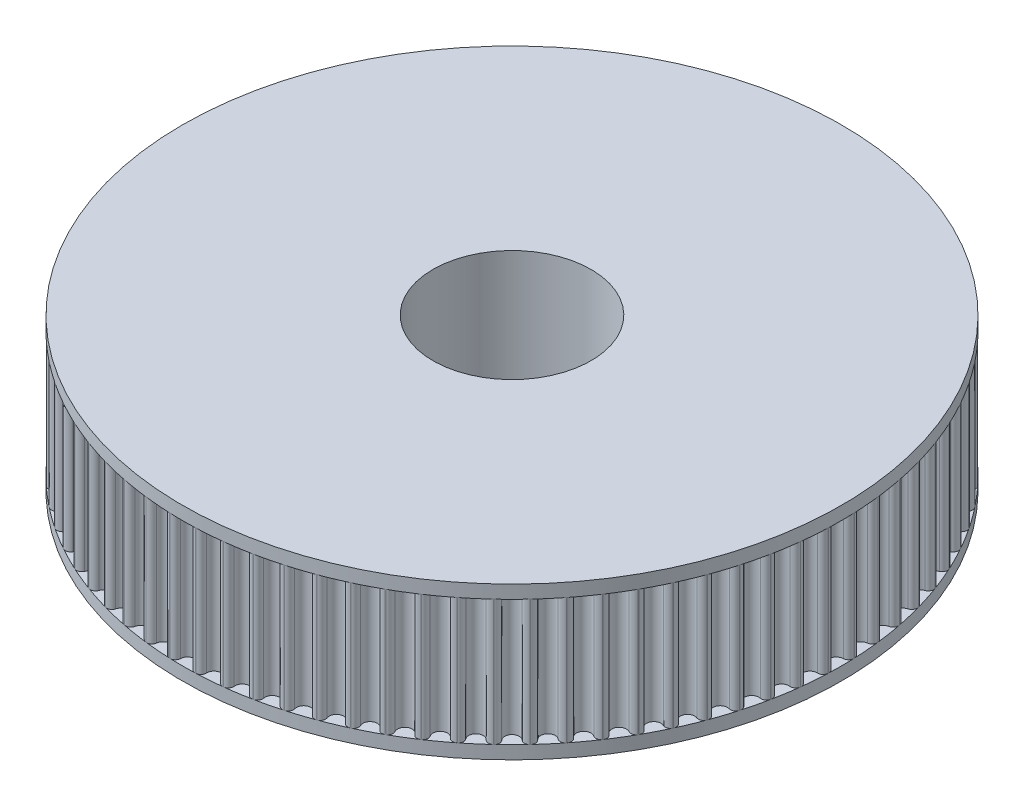
from build123d import *
from build123d.topology import SkipClean

# Parameters (mm, degrees)
CUT_EXTRUDE3_DEPTH  = 25
CIRPATTERN1_COUNT   = 80
SKETCH3_R           = 25
SKETCH3_R_2         = 6
BOSS_EXTRUDE1_DEPTH = 1


with BuildPart() as part:
    # Skica2 → Revolute (revolve)
    with BuildSketch(Plane.XY):
        Polygon((6.118512031, 4.775), (6, 4.775), (6, -4.775), (8.451776633, -4.775), (26, -4.775), (26, -3.775), (25, -3.775), (25, 3.775), (26, 3.775), (26, 4.775), align=None)
    revolve(axis=Axis((0, -9, 0), (0, 1, 0)))

    # Sketch2 → Cut-Extrude3 (cut, symmetric)
    with SkipClean():  # the faces are left unmerged after this step: merging them gives an invalid solid
        with BuildSketch(Plane.XZ.offset(-3.775)):
            with BuildLine():
                ThreePointArc((-0.549744547, 24.593856569), (0, 24.060617627), (0.549744547, 24.593856569))
                ThreePointArc((0.549744547, 24.593856569), (0.676653499, 24.874109381), (0.964998743, 24.981368606))
                ThreePointArc((0.964998743, 24.981368606), (1.744866316, 24.939034495), (2.52303094, 24.872360461))
                ThreePointArc((2.52303094, 24.872360461), (1.700413409, 26.366512204), (0, 26.233158272))
                ThreePointArc((0, 26.233158272), (-1.700413409, 26.366512204), (-2.52303094, 24.872360461))
                ThreePointArc((-2.52303094, 24.872360461), (-1.744866316, 24.939034495), (-0.964998743, 24.981368606))
                ThreePointArc((-0.964998743, 24.981368606), (-0.676653499, 24.874109381), (-0.549744547, 24.593856569))
            make_face()
        cut_extrude3 = extrude(amount=CUT_EXTRUDE3_DEPTH, both=True, mode=Mode.SUBTRACT)

    # CirPattern1: Cut-Extrude3 ×80 about axis
    with SkipClean():  # the faces are left unmerged after this step: merging them gives an invalid solid
        cirpattern1_axis = Axis((0, -9, 0), (0, -1, 0))
        for i in range(1, CIRPATTERN1_COUNT):
            add(cut_extrude3.rotate(cirpattern1_axis, i * 360 / CIRPATTERN1_COUNT), mode=Mode.SUBTRACT)

    # Sketch3 → Boss-Extrude1 (add)
    with BuildSketch(Plane(origin=(0, 4.775, 0), x_dir=(1, 0, 0), z_dir=(0, 1, 0))):
        Circle(SKETCH3_R)
        Circle(SKETCH3_R_2, mode=Mode.SUBTRACT)
    boss_extrude1 = extrude(amount=BOSS_EXTRUDE1_DEPTH)

    # Mirror1: Boss-Extrude1 across plane
    add(boss_extrude1.mirror(Plane.ZX))


solid = part.part
